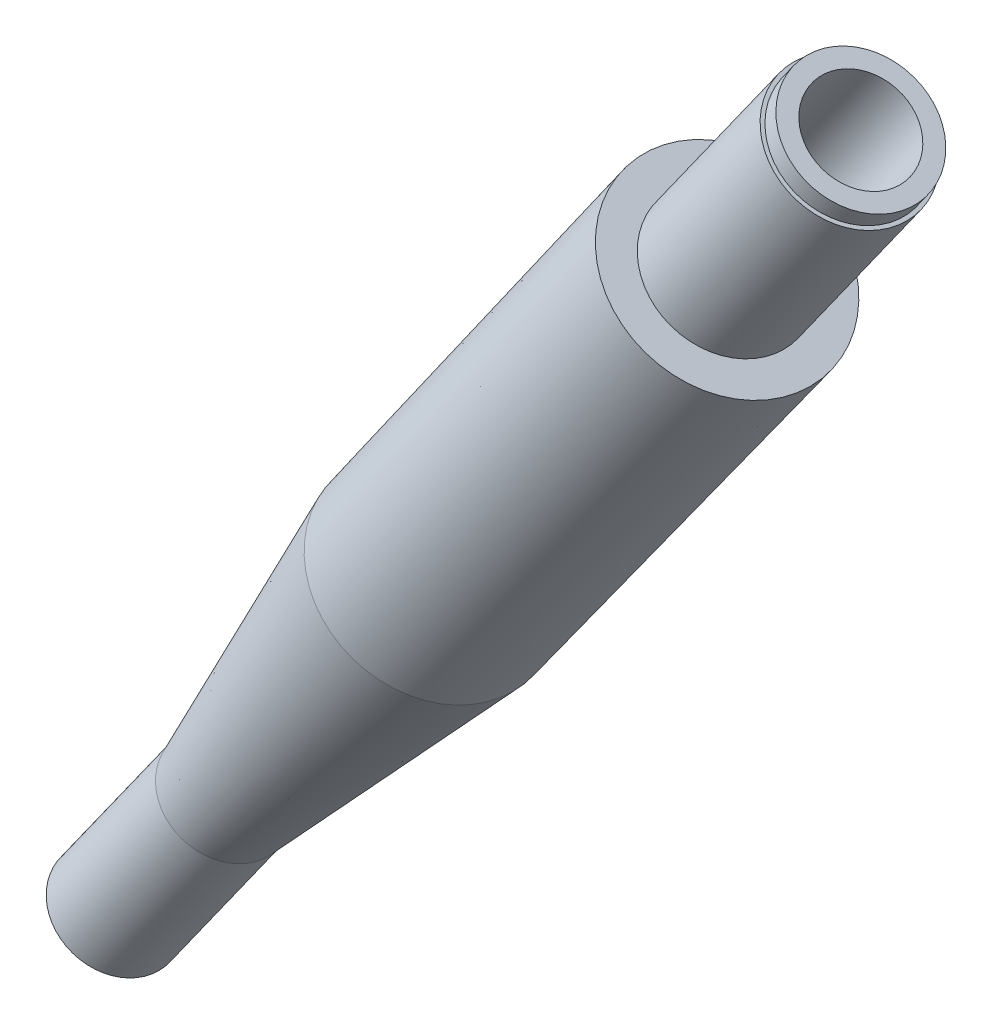
from build123d import *

# Parameters (mm, degrees)
SKETCH2_OUTSIDE_W  = 81.185
SKETCH2_OUTSIDE_H  = 67.044
SKETCH2_OUTSIDE_R  = 3.495
CUT_EXTRUDE1_DEPTH = 1


with BuildPart() as part:
    # Sketch1 → Revolve1 (revolve)
    with BuildSketch(Plane(origin=(96.031948768, 24.259878967, -114.32637478), x_dir=(0.5797540183170993, 0.8147915550895066, 0), z_dir=(0, 0, -1))):
        Polygon((-201.145317806, 47.619722085), (-136.905317806, 47.619722085), (-136.905317806, 47.980853052), (-145.145317806, 47.980853052), (-145.145317806, 50.169722085), (-132.905317806, 50.169722085), (-132.905317806, 51.314722085), (-145.145317806, 51.314722085), (-145.145317806, 53.039722085), (-172.145317806, 52.884722085), (-191.145317806, 50.459722085), (-201.145317806, 50.459722085), align=None)
    revolve(axis=Axis((18.217289915, -167.239352557, -114.32637478), (0.5797540183170992, 0.8147915550895068, 0)))

    # Sketch2 outside → Cut-Extrude1 (cut)
    with BuildSketch(Plane(origin=(-33.314790755, -46.820909057, 0), x_dir=(0.6638852782451765, -0.47237867815397966, -0.5797540183170994), z_dir=(0.5797540183170994, 0.8147915550895066, 0))):
        with Locations((157.4895, 28.254)):
            Rectangle(SKETCH2_OUTSIDE_W, SKETCH2_OUTSIDE_H)
        with Locations((157.375670059, 28.335096914)):
            Circle(SKETCH2_OUTSIDE_R, mode=Mode.SUBTRACT)
    extrude(amount=-CUT_EXTRUDE1_DEPTH, mode=Mode.SUBTRACT)


solid = part.part
